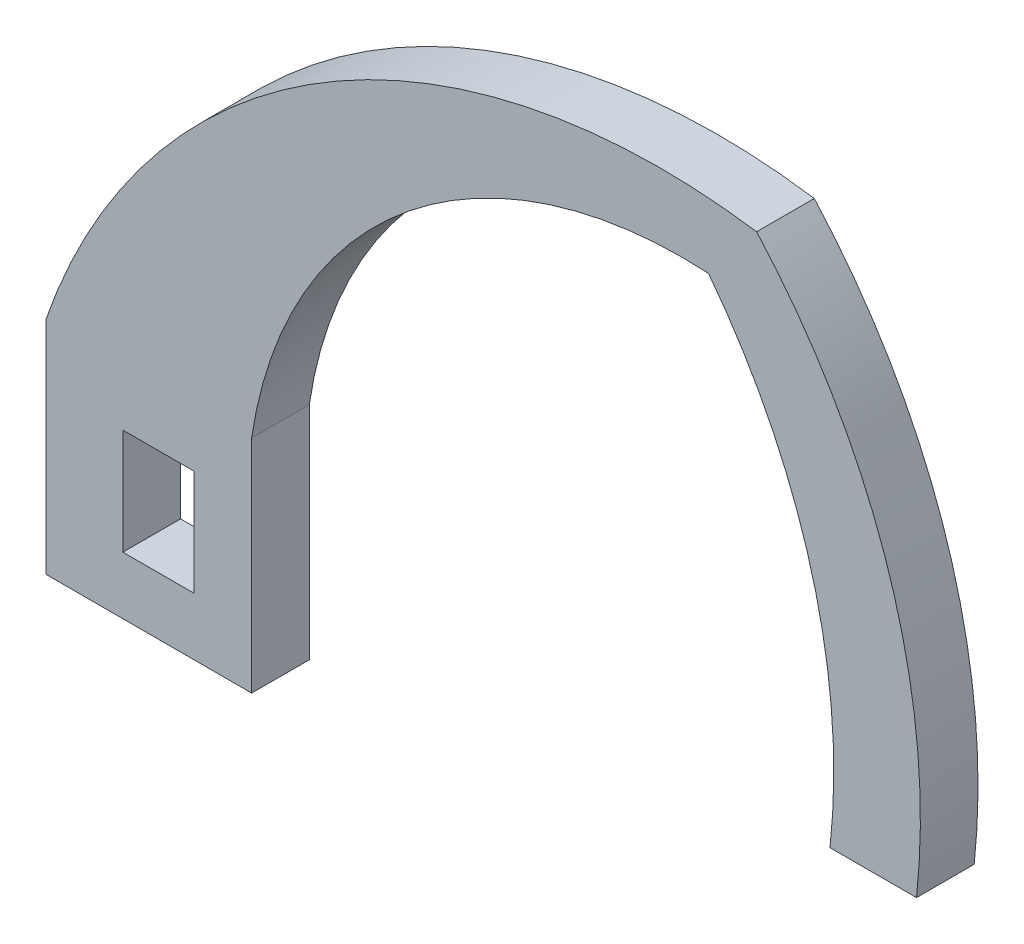
from build123d import *

# Parameters (mm, degrees)
SKETCH1_W           = 3.7
SKETCH1_H           = 5.5
BOSS_EXTRUDE1_DEPTH = 3


with BuildPart() as part:
    # Sketch1 → Boss-Extrude1 (new body)
    with BuildSketch(Plane.XY):
        with BuildLine():
            Line((4.85, 5.75), (4.85, -5.75))
            Line((4.85, -5.75), (-5.85, -5.75))
            Line((-5.85, -5.75), (-5.85, 5.75))
            ThreePointArc((-5.85, 5.75), (8.589567234, 23.63476958), (31.123219897, 28.173556039))
            ThreePointArc((31.123219897, 28.173556039), (38.046416872, 16.141331151), (39.440789318, 2.329712217))
            Line((39.440789318, 2.329712217), (34.938971092, 2.329712217))
            ThreePointArc((34.938971092, 2.329712217), (33.981754894, 14.299726349), (28.619891875, 25.044396012))
            ThreePointArc((28.619891875, 25.044396012), (12.980553865, 20.022452592), (4.85, 5.75))
        make_face()
        Rectangle(SKETCH1_W, SKETCH1_H, mode=Mode.SUBTRACT)
    extrude(amount=BOSS_EXTRUDE1_DEPTH)


solid = part.part
